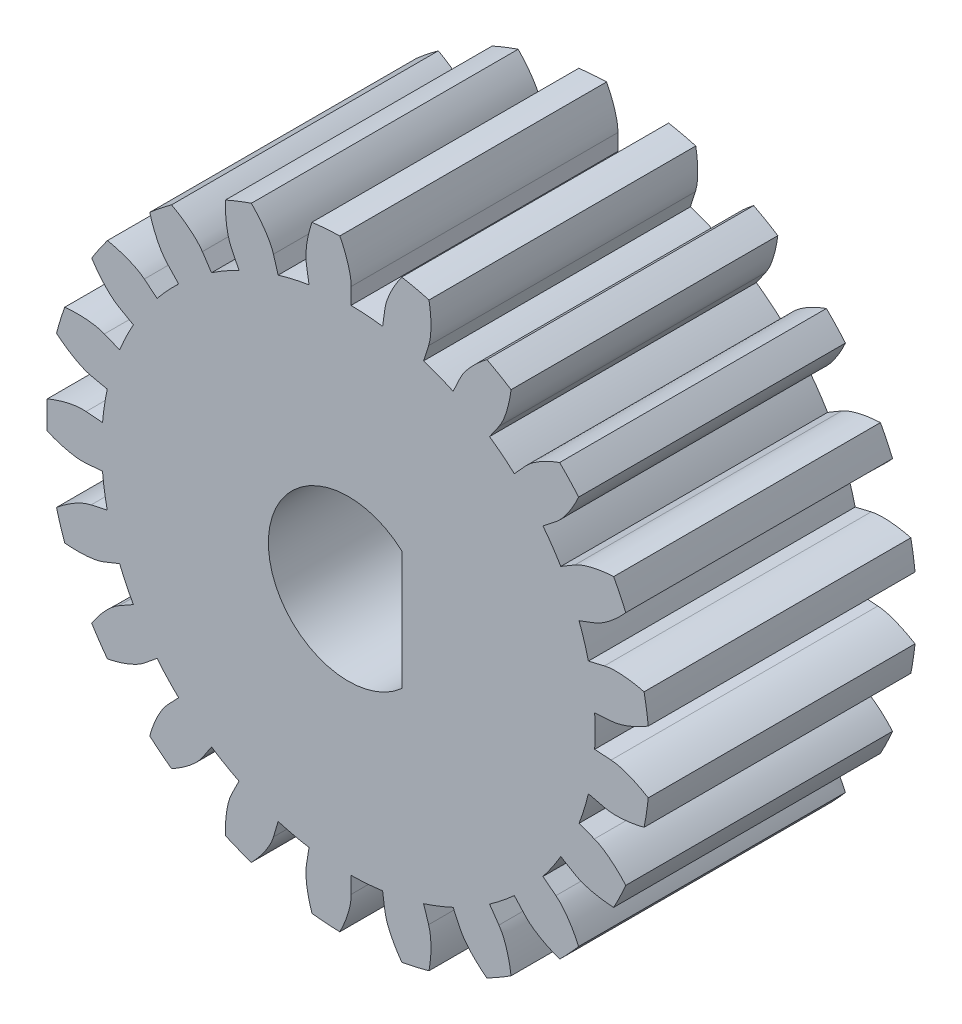
from build123d import *

# Parameters (mm, degrees)
SKETCH_1_R               = 5.75
SKETCH_1_R_2             = 1.475
EXTRUDE_1_DEPTH          = 5
CUT_EXTRUDE_1_DEPTH      = 10.545941546
PATTERN_CIRCULAR_1_DEPTH = 5
SKETCH_2_R               = 1.475
EXTRUDE_2_DEPTH          = 5
CUT_EXTRUDE_2_DEPTH      = 10.543547899
SKETCH_4_OUTSIDE_W       = 16.86
SKETCH_4_OUTSIDE_H       = 16.888
SKETCH_4_OUTSIDE_R       = 5.65
CUT_EXTRUDE_3_DEPTH      = 10.543547899


# Read off the part's stored shape, not the designer's step: 阵列(圆周)1
with BuildPart() as part:
    # 草图1 → 凸台-拉伸1 (new body)
    with BuildSketch(Plane.XY):
        Circle(SKETCH_1_R)
        Circle(SKETCH_1_R_2, mode=Mode.SUBTRACT)
    extrude(amount=EXTRUDE_1_DEPTH)

    # 草图1<3> → 切除-拉伸1 (cut, through all)
    with BuildSketch(Plane.XY):
        with BuildLine():
            Line((4.923195788, 0.316927775), (4.615446536, 0.297116602))
            ThreePointArc((4.615446536, 0.297116602), (4.622611017, 0.148635076), (4.625, 0))
            ThreePointArc((4.625, 0), (4.622611017, -0.148635076), (4.615446536, -0.297116602))
            Line((4.615446536, -0.297116602), (4.923195788, -0.316927775))
            add(Edge.make_bspline(
                [(4.923195788, -0.316927775), (4.960723978, -0.31934363), (5.064950694, -0.333885203), (5.258056408, -0.392528318), (5.454545861, -0.4832362), (5.608701438, -0.573335861), (5.701232058, -0.634072387), (5.713983029, -0.642571358)],
                knots=[0, 0, 0, 0, 0, 0.005604068, 0.015718248, 0.029959916, 0.032248441, 0.032248441, 0.032248441, 0.032248441, 0.032248441], degree=4))
            ThreePointArc((5.713983029, -0.642571358), (5.740988696, -0.321789983), (5.75, 0))
            ThreePointArc((5.75, 0), (5.740988696, 0.321789983), (5.713983029, 0.642571358))
            add(Edge.make_bspline(
                [(4.923195788, 0.316927775), (4.960723978, 0.31934363), (5.064950694, 0.333885203), (5.258056408, 0.392528318), (5.454545861, 0.4832362), (5.608701438, 0.573335861), (5.701232058, 0.634072387), (5.713983029, 0.642571358)],
                knots=[0, 0, 0, 0, 0, 0.005604068, 0.015718248, 0.029959916, 0.032248441, 0.032248441, 0.032248441, 0.032248441, 0.032248441], degree=4))
        make_face()
    extrude(amount=CUT_EXTRUDE_1_DEPTH, mode=Mode.SUBTRACT)

    # 阵列(圆周)1 outline → 阵列(圆周)1 (cut)
    with BuildSketch(Plane.XY):
        with BuildLine():
            Line((4.497971852, 1.076510204), (4.797888114, 1.14828987))
            add(Edge.make_bspline(
                [(4.797888114, 1.14828987), (4.834461118, 1.157042973), (4.938343537, 1.173868805), (5.140155468, 1.174749947), (5.354652063, 1.145988245), (5.528516281, 1.105329614), (5.634838431, 1.07456532), (5.649528027, 1.070202349)],
                knots=[0, 0, 0, 0, 0, 0.005604068, 0.015718248, 0.029959916, 0.032248441, 0.032248441, 0.032248441, 0.032248441, 0.032248441], degree=4))
            ThreePointArc((5.649528027, 1.070202349), (5.494543634, 1.694842253), (5.270725563, 2.298249779))
            add(Edge.make_bspline(
                [(4.611055911, 1.753984996), (4.646204743, 1.76735515), (4.741514754, 1.811972045), (4.908755962, 1.92492872), (5.069779322, 2.069522988), (5.190528858, 2.201057927), (5.261046198, 2.286369979), (5.270725563, 2.298249779)],
                knots=[0, 0, 0, 0, 0, 0.005604068, 0.015718248, 0.029959916, 0.032248441, 0.032248441, 0.032248441, 0.032248441, 0.032248441], degree=4))
            Line((4.611055911, 1.753984996), (4.32281854, 1.644343293))
            ThreePointArc((4.32281854, 1.644343293), (4.419524227, 1.363242682), (4.497971852, 1.076510204))
        make_face()
        with BuildLine():
            add(Edge.make_bspline(
                [(4.611055911, -1.753984996), (4.646204743, -1.76735515), (4.741514754, -1.811972045), (4.908755962, -1.92492872), (5.069779322, -2.069522988), (5.190528858, -2.201057927), (5.261046198, -2.286369979), (5.270725562, -2.298249779)],
                knots=[0, 0, 0, 0, 0, 0.005604068, 0.015718248, 0.029959916, 0.032248441, 0.032248441, 0.032248441, 0.032248441, 0.032248441], degree=4))
            ThreePointArc((5.270725562, -2.298249779), (5.494543634, -1.694842253), (5.649528028, -1.070202349))
            add(Edge.make_bspline(
                [(4.797888114, -1.14828987), (4.834461118, -1.157042973), (4.938343537, -1.173868805), (5.140155468, -1.174749947), (5.354652063, -1.145988245), (5.528516281, -1.105329614), (5.634838431, -1.07456532), (5.649528028, -1.070202349)],
                knots=[0, 0, 0, 0, 0, 0.005604068, 0.015718248, 0.029959916, 0.032248441, 0.032248441, 0.032248441, 0.032248441, 0.032248441], degree=4))
            Line((4.797888114, -1.14828987), (4.497971852, -1.076510204))
            ThreePointArc((4.497971852, -1.076510204), (4.419524227, -1.363242682), (4.32281854, -1.644343293))
            Line((4.32281854, -1.644343293), (4.611055911, -1.753984996))
        make_face()
        with BuildLine():
            add(Edge.make_bspline(
                [(3.889203481, -3.035192954), (3.918849827, -3.058329409), (3.996774421, -3.12905722), (4.123291007, -3.286290758), (4.234540642, -3.471923576), (4.311155011, -3.633206338), (4.353393294, -3.735513566), (4.359141, -3.749718622)],
                knots=[0, 0, 0, 0, 0, 0.005604068, 0.015718248, 0.029959916, 0.032248441, 0.032248441, 0.032248441, 0.032248441, 0.032248441], degree=4))
            ThreePointArc((4.359141, -3.749718622), (4.750872953, -3.239090334), (5.083087669, -2.687883881))
            add(Edge.make_bspline(
                [(4.246267026, -2.511476921), (4.278635171, -2.53062123), (4.372942885, -2.577319418), (4.565529157, -2.637646525), (4.77897393, -2.673386606), (4.957098192, -2.685781701), (5.067764682, -2.687723183), (5.083087669, -2.687883881)],
                knots=[0, 0, 0, 0, 0, 0.005604068, 0.015718248, 0.029959916, 0.032248441, 0.032248441, 0.032248441, 0.032248441, 0.032248441], degree=4))
            Line((4.246267026, -2.511476921), (3.98083263, -2.354484354))
            ThreePointArc((3.98083263, -2.354484354), (3.821354331, -2.605355269), (3.646089147, -2.845462867))
            Line((3.646089147, -2.845462867), (3.889203481, -3.035192954))
        make_face()
        with BuildLine():
            add(Edge.make_bspline(
                [(2.821778254, -4.046710697), (2.843287907, -4.077557678), (2.896903141, -4.168111928), (2.971453551, -4.35565144), (3.023044444, -4.565828519), (3.048716122, -4.742528422), (3.058922292, -4.852740379), (3.060227629, -4.86800851)],
                knots=[0, 0, 0, 0, 0, 0.005604068, 0.015718248, 0.029959916, 0.032248441, 0.032248441, 0.032248441, 0.032248441, 0.032248441], degree=4))
            ThreePointArc((3.060227629, -4.86800851), (3.585066361, -4.495531025), (4.064992664, -4.066735134))
            add(Edge.make_bspline(
                [(3.317346479, -3.651508226), (3.342633714, -3.679342685), (3.418987068, -3.75176389), (3.585235545, -3.866176633), (3.778662992, -3.963242834), (3.945220174, -4.027590298), (4.050397801, -4.062065045), (4.064992664, -4.066735134)],
                knots=[0, 0, 0, 0, 0, 0.005604068, 0.015718248, 0.029959916, 0.032248441, 0.032248441, 0.032248441, 0.032248441, 0.032248441], degree=4))
            Line((3.317346479, -3.651508226), (3.109978959, -3.423252236))
            ThreePointArc((3.109978959, -3.423252236), (2.883640334, -3.615970606), (2.645388733, -3.793750578))
            Line((2.645388733, -3.793750578), (2.821778254, -4.046710697))
        make_face()
        with BuildLine():
            add(Edge.make_bspline(
                [(1.503625646, -4.698660436), (1.515087378, -4.734477054), (1.539629304, -4.836811601), (1.555589407, -5.037993377), (1.54293748, -5.254039561), (1.515385427, -5.430456043), (1.492652621, -5.538779913), (1.489399604, -5.553754479)],
                knots=[0, 0, 0, 0, 0, 0.005604068, 0.015718248, 0.029959916, 0.032248441, 0.032248441, 0.032248441, 0.032248441, 0.032248441], degree=4))
            ThreePointArc((1.489399604, -5.553754479), (2.10071089, -5.352524055), (2.685705221, -5.084239124))
            add(Edge.make_bspline(
                [(2.093665138, -4.467087001), (2.109624581, -4.501138397), (2.161239245, -4.592847677), (2.286378021, -4.751179981), (2.442601265, -4.900947544), (2.58279203, -5.011529822), (2.6731353, -5.075474603), (2.685705221, -5.084239124)],
                knots=[0, 0, 0, 0, 0, 0.005604068, 0.015718248, 0.029959916, 0.032248441, 0.032248441, 0.032248441, 0.032248441, 0.032248441], degree=4))
            Line((2.093665138, -4.467087001), (1.96279001, -4.187849135))
            ThreePointArc((1.96279001, -4.187849135), (1.689702238, -4.305291087), (1.409633921, -4.404946902))
            Line((1.409633921, -4.404946902), (1.503625646, -4.698660436))
        make_face()
        with BuildLine():
            add(Edge.make_bspline(
                [(0.051869301, -4.933113576), (0.052264687, -4.970717367), (0.045552647, -5.075739337), (0.001504318, -5.272687494), (-0.074266251, -5.475406131), (-0.152593914, -5.635863813), (-0.206245786, -5.732674546), (-0.213768111, -5.746024991)],
                knots=[0, 0, 0, 0, 0, 0.005604068, 0.015718248, 0.029959916, 0.032248441, 0.032248441, 0.032248441, 0.032248441, 0.032248441], degree=4))
            ThreePointArc((-0.213768111, -5.746024991), (0.429698038, -5.733921834), (1.067781084, -5.649986156))
            add(Edge.make_bspline(
                [(0.683952463, -4.885745492), (0.689166047, -4.922988208), (0.711455832, -5.025836792), (0.784365777, -5.214020138), (0.889503696, -5.403181558), (0.990871481, -5.550172928), (1.058352997, -5.637905968), (1.067781084, -5.649986156)],
                knots=[0, 0, 0, 0, 0, 0.005604068, 0.015718248, 0.029959916, 0.032248441, 0.032248441, 0.032248441, 0.032248441, 0.032248441], degree=4))
            Line((0.683952463, -4.885745492), (0.641198555, -4.58033726))
            ThreePointArc((0.641198555, -4.58033726), (0.345626683, -4.612067562), (0.048626948, -4.624744363))
            Line((0.048626948, -4.624744363), (0.051869301, -4.933113576))
        make_face()
        with BuildLine():
            add(Edge.make_bspline(
                [(-1.404495859, -4.729237926), (-1.415201951, -4.765287628), (-1.452571563, -4.863665358), (-1.552714436, -5.038880188), (-1.684871098, -5.210258837), (-1.807014616, -5.340500352), (-1.886818351, -5.417195888), (-1.897941592, -5.427735966)],
                knots=[0, 0, 0, 0, 0, 0.005604068, 0.015718248, 0.029959916, 0.032248441, 0.032248441, 0.032248441, 0.032248441, 0.032248441], degree=4))
            ThreePointArc((-1.897941592, -5.427735966), (-1.27949537, -5.605835495), (-0.645020088, -5.713707123))
            add(Edge.make_bspline(
                [(-0.786532391, -4.870284055), (-0.792527914, -4.907408914), (-0.801543555, -5.012258252), (-0.787340809, -5.213571724), (-0.74263018, -5.425319178), (-0.689092349, -5.595658814), (-0.650468614, -5.699384647), (-0.645020088, -5.713707123)],
                knots=[0, 0, 0, 0, 0, 0.005604068, 0.015718248, 0.029959916, 0.032248441, 0.032248441, 0.032248441, 0.032248441, 0.032248441], degree=4))
            Line((-0.786532391, -4.870284055), (-0.737366206, -4.565842319))
            ThreePointArc((-0.737366206, -4.565842319), (-1.02915932, -4.509041594), (-1.316700742, -4.433612991))
            Line((-1.316700742, -4.433612991), (-1.404495859, -4.729237926))
        make_face()
        with BuildLine():
            add(Edge.make_bspline(
                [(-2.736065398, -4.105148733), (-2.756921685, -4.136441171), (-2.821628415, -4.219433368), (-2.968967699, -4.357346265), (-3.145767755, -4.482157182), (-3.300874139, -4.570609997), (-3.399738824, -4.620375602), (-3.413474634, -4.627168781)],
                knots=[0, 0, 0, 0, 0, 0.005604068, 0.015718248, 0.029959916, 0.032248441, 0.032248441, 0.032248441, 0.032248441, 0.032248441], degree=4))
            ThreePointArc((-3.413474634, -4.627168781), (-2.875, -4.979646072), (-2.300508395, -5.269740138))
            add(Edge.make_bspline(
                [(-2.18713039, -4.422076508), (-2.203802293, -4.455784801), (-2.243322279, -4.553318571), (-2.289088709, -4.749874583), (-2.308778105, -4.965393381), (-2.307827299, -5.143945858), (-2.301493234, -5.254447989), (-2.300508395, -5.269740138)],
                knots=[0, 0, 0, 0, 0, 0.005604068, 0.015718248, 0.029959916, 0.032248441, 0.032248441, 0.032248441, 0.032248441, 0.032248441], degree=4))
            Line((-2.18713039, -4.422076508), (-2.050412743, -4.145652251))
            ThreePointArc((-2.050412743, -4.145652251), (-2.3125, -4.005367493), (-2.565033793, -3.848535649))
            Line((-2.565033793, -3.848535649), (-2.736065398, -4.105148733))
        make_face()
        with BuildLine():
            add(Edge.make_bspline(
                [(-3.82452352, -3.116299059), (-3.853676829, -3.140053764), (-3.939971199, -3.200286207), (-4.121415153, -3.288643004), (-4.327149142, -3.355796191), (-4.501436509, -3.394600886), (-4.610577583, -3.413014668), (-4.625705474, -3.415457344)],
                knots=[0, 0, 0, 0, 0, 0.005604068, 0.015718248, 0.029959916, 0.032248441, 0.032248441, 0.032248441, 0.032248441, 0.032248441], degree=4))
            ThreePointArc((-4.625705474, -3.415457344), (-4.215048263, -3.910993242), (-3.751586435, -4.357533617))
            add(Edge.make_bspline(
                [(-3.393392255, -3.580948056), (-3.419259167, -3.608244655), (-3.485771974, -3.689796553), (-3.587441031, -3.864130241), (-3.669780964, -4.064270592), (-3.721501666, -4.235170738), (-3.748020081, -4.342630568), (-3.751586435, -4.357533617)],
                knots=[0, 0, 0, 0, 0, 0.005604068, 0.015718248, 0.029959916, 0.032248441, 0.032248441, 0.032248441, 0.032248441, 0.032248441], degree=4))
            Line((-3.393392255, -3.580948056), (-3.18127111, -3.357102787))
            ThreePointArc((-3.18127111, -3.357102787), (-3.390364907, -3.145798912), (-3.585452335, -2.921499025))
            Line((-3.585452335, -2.921499025), (-3.82452352, -3.116299059))
        make_face()
        with BuildLine():
            add(Edge.make_bspline(
                [(-4.573155944, -1.850552538), (-4.608015875, -1.8646588), (-4.708230253, -1.896779572), (-4.907656784, -1.92772938), (-5.124044338, -1.931257982), (-5.302026492, -1.91696659), (-5.411746291, -1.902392403), (-5.426922084, -1.900267533)],
                knots=[0, 0, 0, 0, 0, 0.005604068, 0.015718248, 0.029959916, 0.032248441, 0.032248441, 0.032248441, 0.032248441, 0.032248441], degree=4))
            ThreePointArc((-5.426922084, -1.900267533), (-5.18057099, -2.4948315), (-4.869319557, -3.05814111))
            add(Edge.make_bspline(
                [(-4.298136328, -2.421636656), (-4.330899858, -2.440096137), (-4.418495532, -2.498419919), (-4.567033475, -2.635040969), (-4.70470768, -2.802019525), (-4.804504278, -2.950082113), (-4.861518895, -3.044951364), (-4.869319557, -3.05814111)],
                knots=[0, 0, 0, 0, 0, 0.005604068, 0.015718248, 0.029959916, 0.032248441, 0.032248441, 0.032248441, 0.032248441, 0.032248441], degree=4))
            Line((-4.298136328, -2.421636656), (-4.029459578, -2.270260009))
            ThreePointArc((-4.029459578, -2.270260009), (-4.166981014, -2.006712294), (-4.287287702, -1.734874393))
            Line((-4.287287702, -1.734874393), (-4.573155944, -1.850552538))
        make_face()
        with BuildLine():
            add(Edge.make_bspline(
                [(-4.915443393, -0.420376303), (-4.952912488, -0.423580718), (-5.058142386, -0.424735748), (-5.257831572, -0.395528542), (-5.465645708, -0.335119025), (-5.631508153, -0.2690014), (-5.732057592, -0.222734224), (-5.74593285, -0.216230613)],
                knots=[0, 0, 0, 0, 0, 0.005604068, 0.015718248, 0.029959916, 0.032248441, 0.032248441, 0.032248441, 0.032248441, 0.032248441], degree=4))
            ThreePointArc((-5.74593285, -0.216230613), (-5.685777251, -0.856993031), (-5.554392268, -1.487019346))
            add(Edge.make_bspline(
                [(-4.820972125, -1.047152211), (-4.857721092, -1.055134369), (-4.958616372, -1.085047711), (-5.140824952, -1.171816744), (-5.321600472, -1.290796727), (-5.460605601, -1.402865745), (-5.543050421, -1.476714868), (-5.554392268, -1.487019346)],
                knots=[0, 0, 0, 0, 0, 0.005604068, 0.015718248, 0.029959916, 0.032248441, 0.032248441, 0.032248441, 0.032248441, 0.032248441], degree=4))
            Line((-4.820972125, -1.047152211), (-4.51961288, -0.981694666))
            ThreePointArc((-4.51961288, -0.981694666), (-4.573342571, -0.689320481), (-4.608178743, -0.394098556))
            Line((-4.608178743, -0.394098556), (-4.915443393, -0.420376303))
        make_face()
        with BuildLine():
            add(Edge.make_bspline(
                [(-4.820972125, 1.047152211), (-4.857721092, 1.055134369), (-4.958616372, 1.085047711), (-5.140824952, 1.171816744), (-5.321600472, 1.290796727), (-5.460605601, 1.402865745), (-5.543050421, 1.476714868), (-5.554392268, 1.487019346)],
                knots=[0, 0, 0, 0, 0, 0.005604068, 0.015718248, 0.029959916, 0.032248441, 0.032248441, 0.032248441, 0.032248441, 0.032248441], degree=4))
            ThreePointArc((-5.554392268, 1.487019346), (-5.685777251, 0.856993031), (-5.74593285, 0.216230613))
            add(Edge.make_bspline(
                [(-4.915443393, 0.420376303), (-4.952912488, 0.423580718), (-5.058142386, 0.424735748), (-5.257831572, 0.395528542), (-5.465645708, 0.335119025), (-5.631508153, 0.2690014), (-5.732057592, 0.222734224), (-5.74593285, 0.216230613)],
                knots=[0, 0, 0, 0, 0, 0.005604068, 0.015718248, 0.029959916, 0.032248441, 0.032248441, 0.032248441, 0.032248441, 0.032248441], degree=4))
            Line((-4.915443393, 0.420376303), (-4.608178743, 0.394098556))
            ThreePointArc((-4.608178743, 0.394098556), (-4.573342571, 0.689320481), (-4.51961288, 0.981694666))
            Line((-4.51961288, 0.981694666), (-4.820972125, 1.047152211))
        make_face()
        with BuildLine():
            add(Edge.make_bspline(
                [(-4.298136328, 2.421636656), (-4.330899858, 2.440096137), (-4.418495532, 2.498419919), (-4.567033475, 2.635040969), (-4.70470768, 2.802019525), (-4.804504278, 2.950082113), (-4.861518895, 3.044951364), (-4.869319557, 3.05814111)],
                knots=[0, 0, 0, 0, 0, 0.005604068, 0.015718248, 0.029959916, 0.032248441, 0.032248441, 0.032248441, 0.032248441, 0.032248441], degree=4))
            ThreePointArc((-4.869319557, 3.05814111), (-5.18057099, 2.4948315), (-5.426922084, 1.900267533))
            add(Edge.make_bspline(
                [(-4.573155944, 1.850552538), (-4.608015875, 1.8646588), (-4.708230253, 1.896779572), (-4.907656784, 1.92772938), (-5.124044338, 1.931257982), (-5.302026492, 1.91696659), (-5.411746291, 1.902392403), (-5.426922084, 1.900267533)],
                knots=[0, 0, 0, 0, 0, 0.005604068, 0.015718248, 0.029959916, 0.032248441, 0.032248441, 0.032248441, 0.032248441, 0.032248441], degree=4))
            Line((-4.573155944, 1.850552538), (-4.287287702, 1.734874393))
            ThreePointArc((-4.287287702, 1.734874393), (-4.166981014, 2.006712294), (-4.029459578, 2.270260009))
            Line((-4.029459578, 2.270260009), (-4.298136328, 2.421636656))
        make_face()
        with BuildLine():
            add(Edge.make_bspline(
                [(-3.393392255, 3.580948056), (-3.419259167, 3.608244655), (-3.485771974, 3.689796553), (-3.587441031, 3.864130241), (-3.669780964, 4.064270592), (-3.721501666, 4.235170738), (-3.748020081, 4.342630568), (-3.751586435, 4.357533617)],
                knots=[0, 0, 0, 0, 0, 0.005604068, 0.015718248, 0.029959916, 0.032248441, 0.032248441, 0.032248441, 0.032248441, 0.032248441], degree=4))
            ThreePointArc((-3.751586435, 4.357533617), (-4.215048263, 3.910993242), (-4.625705474, 3.415457344))
            add(Edge.make_bspline(
                [(-3.82452352, 3.116299059), (-3.853676829, 3.140053764), (-3.939971199, 3.200286207), (-4.121415153, 3.288643004), (-4.327149142, 3.355796191), (-4.501436509, 3.394600886), (-4.610577583, 3.413014668), (-4.625705474, 3.415457344)],
                knots=[0, 0, 0, 0, 0, 0.005604068, 0.015718248, 0.029959916, 0.032248441, 0.032248441, 0.032248441, 0.032248441, 0.032248441], degree=4))
            Line((-3.82452352, 3.116299059), (-3.585452335, 2.921499025))
            ThreePointArc((-3.585452335, 2.921499025), (-3.390364907, 3.145798912), (-3.18127111, 3.357102787))
            Line((-3.18127111, 3.357102787), (-3.393392255, 3.580948056))
        make_face()
        with BuildLine():
            add(Edge.make_bspline(
                [(-2.18713039, 4.422076508), (-2.203802293, 4.455784801), (-2.243322279, 4.553318571), (-2.289088709, 4.749874583), (-2.308778105, 4.965393381), (-2.307827299, 5.143945858), (-2.301493234, 5.254447989), (-2.300508395, 5.269740138)],
                knots=[0, 0, 0, 0, 0, 0.005604068, 0.015718248, 0.029959916, 0.032248441, 0.032248441, 0.032248441, 0.032248441, 0.032248441], degree=4))
            ThreePointArc((-2.300508395, 5.269740138), (-2.875, 4.979646072), (-3.413474634, 4.627168781))
            add(Edge.make_bspline(
                [(-2.736065398, 4.105148733), (-2.756921685, 4.136441171), (-2.821628415, 4.219433368), (-2.968967699, 4.357346265), (-3.145767755, 4.482157182), (-3.300874139, 4.570609997), (-3.399738824, 4.620375602), (-3.413474634, 4.627168781)],
                knots=[0, 0, 0, 0, 0, 0.005604068, 0.015718248, 0.029959916, 0.032248441, 0.032248441, 0.032248441, 0.032248441, 0.032248441], degree=4))
            Line((-2.736065398, 4.105148733), (-2.565033793, 3.848535649))
            ThreePointArc((-2.565033793, 3.848535649), (-2.3125, 4.005367493), (-2.050412743, 4.145652251))
            Line((-2.050412743, 4.145652251), (-2.18713039, 4.422076508))
        make_face()
        with BuildLine():
            add(Edge.make_bspline(
                [(-0.786532391, 4.870284055), (-0.792527914, 4.907408914), (-0.801543555, 5.012258252), (-0.787340809, 5.213571724), (-0.74263018, 5.425319178), (-0.689092349, 5.595658814), (-0.650468614, 5.699384647), (-0.645020088, 5.713707123)],
                knots=[0, 0, 0, 0, 0, 0.005604068, 0.015718248, 0.029959916, 0.032248441, 0.032248441, 0.032248441, 0.032248441, 0.032248441], degree=4))
            ThreePointArc((-0.645020088, 5.713707123), (-1.27949537, 5.605835495), (-1.897941592, 5.427735966))
            add(Edge.make_bspline(
                [(-1.404495859, 4.729237926), (-1.415201951, 4.765287628), (-1.452571563, 4.863665358), (-1.552714436, 5.038880188), (-1.684871098, 5.210258837), (-1.807014616, 5.340500352), (-1.886818351, 5.417195888), (-1.897941592, 5.427735966)],
                knots=[0, 0, 0, 0, 0, 0.005604068, 0.015718248, 0.029959916, 0.032248441, 0.032248441, 0.032248441, 0.032248441, 0.032248441], degree=4))
            Line((-1.404495859, 4.729237926), (-1.316700742, 4.433612991))
            ThreePointArc((-1.316700742, 4.433612991), (-1.02915932, 4.509041594), (-0.737366206, 4.565842319))
            Line((-0.737366206, 4.565842319), (-0.786532391, 4.870284055))
        make_face()
        with BuildLine():
            add(Edge.make_bspline(
                [(0.683952463, 4.885745492), (0.689166047, 4.922988208), (0.711455832, 5.025836792), (0.784365777, 5.214020138), (0.889503696, 5.403181558), (0.990871481, 5.550172928), (1.058352997, 5.637905968), (1.067781084, 5.649986155)],
                knots=[0, 0, 0, 0, 0, 0.005604068, 0.015718248, 0.029959916, 0.032248441, 0.032248441, 0.032248441, 0.032248441, 0.032248441], degree=4))
            ThreePointArc((1.067781084, 5.649986155), (0.429698038, 5.733921834), (-0.213768111, 5.746024991))
            add(Edge.make_bspline(
                [(0.051869301, 4.933113576), (0.052264687, 4.970717367), (0.045552647, 5.075739337), (0.001504318, 5.272687494), (-0.074266251, 5.475406131), (-0.152593914, 5.635863813), (-0.206245786, 5.732674546), (-0.213768111, 5.746024991)],
                knots=[0, 0, 0, 0, 0, 0.005604068, 0.015718248, 0.029959916, 0.032248441, 0.032248441, 0.032248441, 0.032248441, 0.032248441], degree=4))
            Line((0.051869301, 4.933113576), (0.048626948, 4.624744363))
            ThreePointArc((0.048626948, 4.624744363), (0.345626683, 4.612067562), (0.641198555, 4.58033726))
            Line((0.641198555, 4.58033726), (0.683952463, 4.885745492))
        make_face()
        with BuildLine():
            add(Edge.make_bspline(
                [(2.093665138, 4.467087001), (2.109624581, 4.501138397), (2.161239245, 4.592847677), (2.286378021, 4.751179981), (2.442601265, 4.900947544), (2.58279203, 5.011529822), (2.6731353, 5.075474603), (2.685705221, 5.084239123)],
                knots=[0, 0, 0, 0, 0, 0.005604068, 0.015718248, 0.029959916, 0.032248441, 0.032248441, 0.032248441, 0.032248441, 0.032248441], degree=4))
            ThreePointArc((2.685705221, 5.084239123), (2.10071089, 5.352524055), (1.489399605, 5.55375448))
            add(Edge.make_bspline(
                [(1.503625646, 4.698660436), (1.515087378, 4.734477054), (1.539629304, 4.836811601), (1.555589407, 5.037993377), (1.54293748, 5.254039561), (1.515385427, 5.430456043), (1.492652621, 5.538779913), (1.489399605, 5.55375448)],
                knots=[0, 0, 0, 0, 0, 0.005604068, 0.015718248, 0.029959916, 0.032248441, 0.032248441, 0.032248441, 0.032248441, 0.032248441], degree=4))
            Line((1.503625646, 4.698660436), (1.409633921, 4.404946902))
            ThreePointArc((1.409633921, 4.404946902), (1.689702238, 4.305291087), (1.96279001, 4.187849135))
            Line((1.96279001, 4.187849135), (2.093665138, 4.467087001))
        make_face()
        with BuildLine():
            add(Edge.make_bspline(
                [(3.317346479, 3.651508226), (3.342633714, 3.679342685), (3.418987068, 3.75176389), (3.585235545, 3.866176633), (3.778662992, 3.963242834), (3.945220174, 4.027590298), (4.050397801, 4.062065045), (4.064992663, 4.066735134)],
                knots=[0, 0, 0, 0, 0, 0.005604068, 0.015718248, 0.029959916, 0.032248441, 0.032248441, 0.032248441, 0.032248441, 0.032248441], degree=4))
            ThreePointArc((4.064992663, 4.066735134), (3.585066361, 4.495531025), (3.060227629, 4.868008511))
            add(Edge.make_bspline(
                [(2.821778254, 4.046710697), (2.843287907, 4.077557678), (2.896903141, 4.168111928), (2.971453551, 4.35565144), (3.023044444, 4.565828519), (3.048716122, 4.742528422), (3.058922292, 4.852740379), (3.060227629, 4.868008511)],
                knots=[0, 0, 0, 0, 0, 0.005604068, 0.015718248, 0.029959916, 0.032248441, 0.032248441, 0.032248441, 0.032248441, 0.032248441], degree=4))
            Line((2.821778254, 4.046710697), (2.645388733, 3.793750578))
            ThreePointArc((2.645388733, 3.793750578), (2.883640334, 3.615970606), (3.109978959, 3.423252236))
            Line((3.109978959, 3.423252236), (3.317346479, 3.651508226))
        make_face()
        with BuildLine():
            add(Edge.make_bspline(
                [(4.246267026, 2.511476921), (4.278635171, 2.53062123), (4.372942885, 2.577319418), (4.565529157, 2.637646525), (4.77897393, 2.673386606), (4.957098192, 2.685781701), (5.067764682, 2.687723183), (5.083087668, 2.687883881)],
                knots=[0, 0, 0, 0, 0, 0.005604068, 0.015718248, 0.029959916, 0.032248441, 0.032248441, 0.032248441, 0.032248441, 0.032248441], degree=4))
            ThreePointArc((5.083087668, 2.687883881), (4.750872953, 3.239090334), (4.359141, 3.749718623))
            add(Edge.make_bspline(
                [(3.889203481, 3.035192954), (3.918849827, 3.058329409), (3.996774421, 3.12905722), (4.123291007, 3.286290758), (4.234540642, 3.471923576), (4.311155011, 3.633206338), (4.353393294, 3.735513566), (4.359141, 3.749718623)],
                knots=[0, 0, 0, 0, 0, 0.005604068, 0.015718248, 0.029959916, 0.032248441, 0.032248441, 0.032248441, 0.032248441, 0.032248441], degree=4))
            Line((3.889203481, 3.035192954), (3.646089147, 2.845462867))
            ThreePointArc((3.646089147, 2.845462867), (3.821354331, 2.605355269), (3.98083263, 2.354484354))
            Line((3.98083263, 2.354484354), (4.246267026, 2.511476921))
        make_face()
    extrude(amount=PATTERN_CIRCULAR_1_DEPTH, mode=Mode.SUBTRACT)

    # 草图2 → 凸台-拉伸2 (add, through all)
    with BuildSketch(Plane.XY.offset(5)):
        Circle(SKETCH_2_R)
    extrude(amount=-EXTRUDE_2_DEPTH)

    # 草图3 → 切除-拉伸2 (cut, through all)
    with BuildSketch(Plane.XY.offset(5)):
        with BuildLine():
            Line((1, -1.118033989), (1, 1.118033989))
            ThreePointArc((1, 1.118033989), (-1.5, 0), (1, -1.118033989))
        make_face()
    extrude(amount=-CUT_EXTRUDE_2_DEPTH, mode=Mode.SUBTRACT)

    # 草图4 outside → 切除-拉伸3 (cut, through all)
    with BuildSketch(Plane.XY.offset(5)):
        with Locations((-0.018, 0)):
            Rectangle(SKETCH_4_OUTSIDE_W, SKETCH_4_OUTSIDE_H)
        Circle(SKETCH_4_OUTSIDE_R, mode=Mode.SUBTRACT)
    extrude(amount=-CUT_EXTRUDE_3_DEPTH, mode=Mode.SUBTRACT)


solid = part.part
